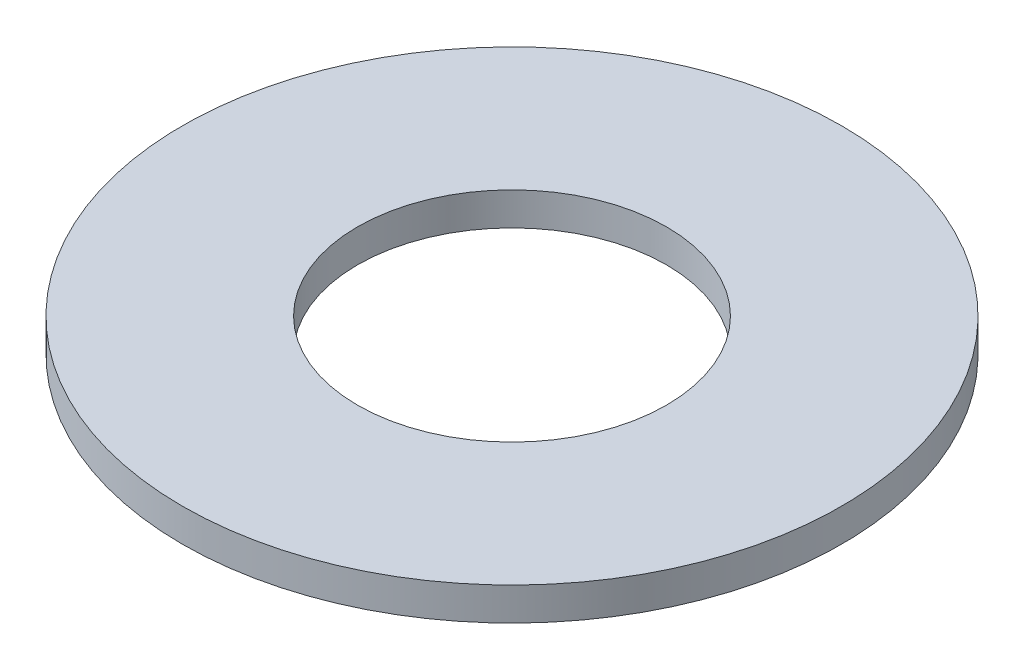
from build123d import *

# Parameters (mm, degrees)
SKETCH1_R           = 80
BOSS_EXTRUDE1_DEPTH = 8
SKETCH2_R           = 37.5
CUT_EXTRUDE1_DEPTH  = 114.41957503


with BuildPart() as part:
    # Sketch1 → Boss-Extrude1 (new body)
    with BuildSketch(Plane(origin=(0, 0, 0), x_dir=(1, 0, 0), z_dir=(0, 1, 0))):
        Circle(SKETCH1_R)
    extrude(amount=BOSS_EXTRUDE1_DEPTH)

    # Sketch2 → Cut-Extrude1 (cut, through all)
    with BuildSketch(Plane(origin=(0, 0, 0), x_dir=(1, 0, 0), z_dir=(0, 1, 0))):
        Circle(SKETCH2_R)
    extrude(amount=CUT_EXTRUDE1_DEPTH, mode=Mode.SUBTRACT)


solid = part.part
